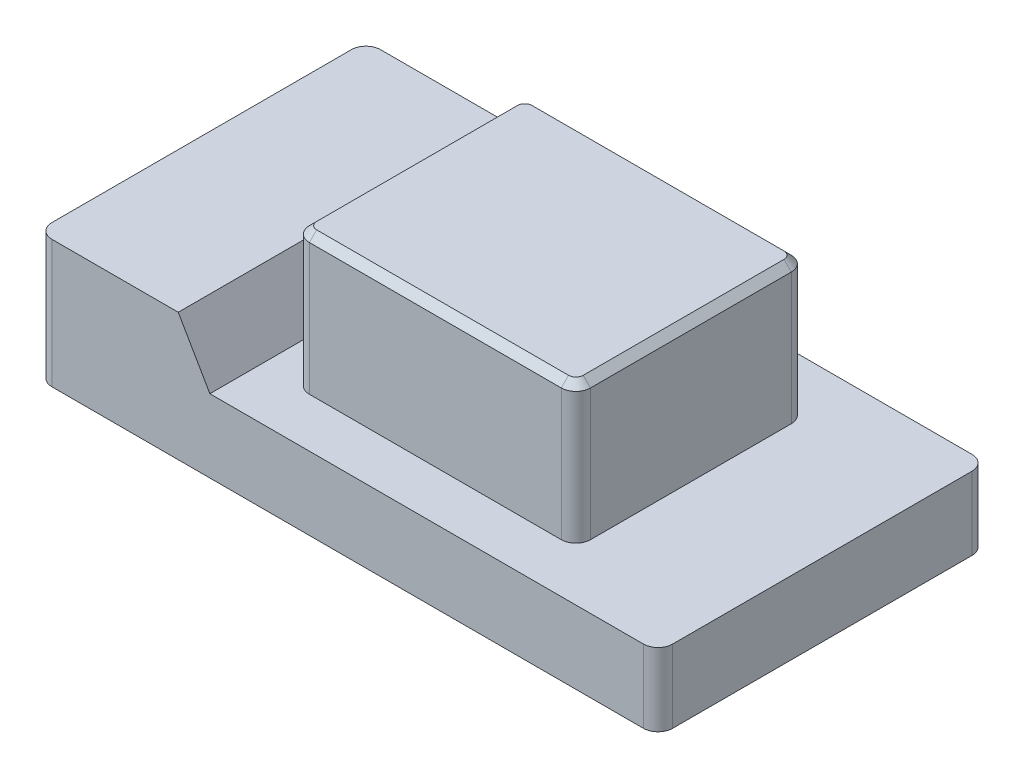
from build123d import *

# Parameters (mm, degrees)
SKETCH_1_W       = 85
SKETCH_1_H       = 45
EXTRUDE_1_DEPTH  = 10
SKETCH_2_W       = 19
SKETCH_2_H       = 45
EXTRUDE_2_DEPTH  = 7.5
CHAMFER_1_SIZE   = 8
CHAMFER_1_SIZE_2 = 4.618802154
SKETCH_3_W       = 38.5
SKETCH_3_H       = 31.5
EXTRUDE_3_DEPTH  = 19
FILLET_1_R       = 2
CHAMFER_2_SIZE   = 1
FILLET_2_R       = 2


with BuildPart() as part:
    # 草图1 → 凸台-拉伸1 (new body)
    with BuildSketch(Plane(origin=(0, 0, 0), x_dir=(1, 0, 0), z_dir=(0, 1, 0))):
        Rectangle(SKETCH_1_W, SKETCH_1_H)
    extrude(amount=EXTRUDE_1_DEPTH)

    # 草图2 → 凸台-拉伸2 (add)
    with BuildSketch(Plane(origin=(0, 10, 0), x_dir=(1, 0, 0), z_dir=(0, 1, 0))):
        with Locations((-33, 0)):
            Rectangle(SKETCH_2_W, SKETCH_2_H)
    extrude(amount=EXTRUDE_2_DEPTH)

    # 倒角1
    # the kernel refuses this chamfer: 8, 4.618802154 mm, written as the material it adds along each edge
    with BuildSketch(Plane(origin=(-23.5, 10, -22.5), x_dir=(-0.01932676561270072, 0.9998132206222079, 0), z_dir=(0, 0, 1))) as chamfer_1_piece_1_section:
        Polygon((CHAMFER_1_SIZE * 0.999813220622, -CHAMFER_1_SIZE * 0.0193267656127), (-CHAMFER_1_SIZE_2 * 0.0193267656107, -CHAMFER_1_SIZE_2 * 0.999813220518), (0, 0), align=None)
    chamfer_1_piece_1 = extrude(amount=45, mode=Mode.PRIVATE)
    chamfer_1_piece_1 = split(chamfer_1_piece_1, bisect_by=Plane(origin=(-21.997429692, 17.5, 0), z_dir=(0, -1, 0)), keep=Keep.TOP, mode=Mode.PRIVATE)
    add(chamfer_1_piece_1)

    # 草图3 → 凸台-拉伸3 (add)
    with BuildSketch(Plane(origin=(0, 10, 0), x_dir=(1, 0, 0), z_dir=(0, 1, 0))):
        with Locations((5.25, 0)):
            Rectangle(SKETCH_3_W, SKETCH_3_H)
    extrude(amount=EXTRUDE_3_DEPTH)

    # 圆角1
    fillet_1_edges = [part.edges().sort_by_distance(p)[0] for p in [
        (-14, 19.5, -15.75),
        (-14, 19.5, 15.75),
        (24.5, 19.5, 15.75),
        (24.5, 19.5, -15.75),
    ]]
    fillet(fillet_1_edges, radius=FILLET_1_R)

    # 倒角2
    chamfer_2_edges = [part.edges().sort_by_distance(p)[0] for p in [
        (-14, 29, 0),
        (5.25, 29, -15.75),
        (5.25, 29, 15.75),
        (24.5, 29, 0),
        (-13.414213562, 29, 15.164213562),
        (23.914213562, 29, 15.164213562),
        (23.914213562, 29, -15.164213562),
        (-13.414213562, 29, -15.164213562),
    ]]
    chamfer(chamfer_2_edges, length=CHAMFER_2_SIZE)

    # 圆角2
    fillet_2_edges = [part.edges().sort_by_distance(p)[0] for p in [
        (-42.5, 8.75, -22.5),
        (42.5, 5, -22.5),
        (42.5, 5, 22.5),
        (-42.5, 8.75, 22.5),
    ]]
    fillet(fillet_2_edges, radius=FILLET_2_R)


solid = part.part
